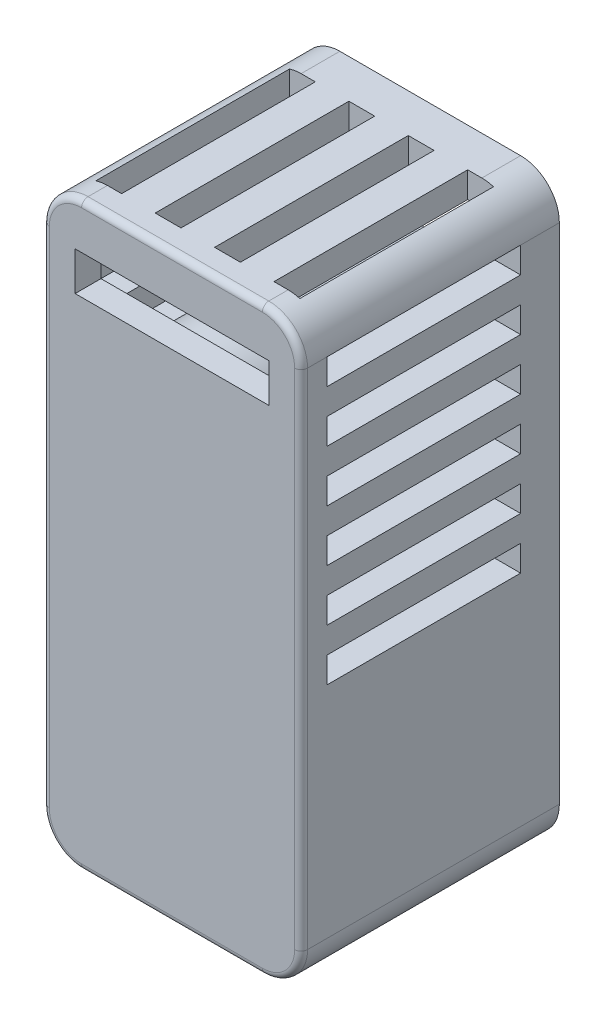
from build123d import *

# Parameters (mm, degrees)
SKETCH2_W           = 20
SKETCH2_H           = 45
BOSS_EXTRUDE1_DEPTH = 20
SHELL1_T            = -2
CUT_EXTRUDE1_REACH  = 38.142
SKETCH3_W           = 15
SKETCH3_H           = 2
CUT_EXTRUDE2_REACH  = 52.249
SKETCH4_W           = 2
SKETCH4_H           = 15
FILLET1_R           = 3
SKETCH7_W           = 15
SKETCH7_H           = 3
CUT_EXTRUDE3_DEPTH  = 2
FILLET3_R           = 0.5
SKETCH8_R           = 5.2
SKETCH8_R_2         = 2.8
BOSS_EXTRUDE2_DEPTH = 16.4


with BuildPart() as part:
    # Sketch2 → Boss-Extrude1 (new body)
    with BuildSketch(Plane.XY):
        Rectangle(SKETCH2_W, SKETCH2_H)
    extrude(amount=BOSS_EXTRUDE1_DEPTH)

    # Shell1
    shell1_openings = [part.faces().sort_by_distance(p)[0] for p in [
        (0, 0, 0),
    ]]
    offset(amount=SHELL1_T, openings=shell1_openings, kind=Kind.INTERSECTION)

    # Cut-Extrude1: up to this face of the body (flat: up to its plane)
    cut_extrude1_end = Plane(part.part.faces().sort_by_distance((-10, 0, 10))[0])
    # Sketch3 → Cut-Extrude1 (cut, up to the picked face)
    with BuildSketch(Plane(origin=(10, 0, 0), x_dir=(0, 0, -1), z_dir=(1, 0, 0)), mode=Mode.PRIVATE) as cut_extrude1_sk1:
        with Locations((-10.5, 18.5)):
            Rectangle(SKETCH3_W, SKETCH3_H)
    cut_extrude1_tool1 = split(extrude(cut_extrude1_sk1.sketch, amount=-CUT_EXTRUDE1_REACH, mode=Mode.PRIVATE), bisect_by=cut_extrude1_end, keep=Keep.BOTH, mode=Mode.PRIVATE)
    # Sketch3 → Cut-Extrude1 (cut, up to the picked face)
    with BuildSketch(Plane(origin=(10, 0, 0), x_dir=(0, 0, -1), z_dir=(1, 0, 0)), mode=Mode.PRIVATE) as cut_extrude1_sk2:
        with Locations((-10.5, 14.5)):
            Rectangle(SKETCH3_W, SKETCH3_H)
    cut_extrude1_tool2 = split(extrude(cut_extrude1_sk2.sketch, amount=-CUT_EXTRUDE1_REACH, mode=Mode.PRIVATE), bisect_by=cut_extrude1_end, keep=Keep.BOTH, mode=Mode.PRIVATE)
    # Sketch3 → Cut-Extrude1 (cut, up to the picked face)
    with BuildSketch(Plane(origin=(10, 0, 0), x_dir=(0, 0, -1), z_dir=(1, 0, 0)), mode=Mode.PRIVATE) as cut_extrude1_sk3:
        with Locations((-10.5, 10.5)):
            Rectangle(SKETCH3_W, SKETCH3_H)
    cut_extrude1_tool3 = split(extrude(cut_extrude1_sk3.sketch, amount=-CUT_EXTRUDE1_REACH, mode=Mode.PRIVATE), bisect_by=cut_extrude1_end, keep=Keep.BOTH, mode=Mode.PRIVATE)
    # Sketch3 → Cut-Extrude1 (cut, up to the picked face)
    with BuildSketch(Plane(origin=(10, 0, 0), x_dir=(0, 0, -1), z_dir=(1, 0, 0)), mode=Mode.PRIVATE) as cut_extrude1_sk4:
        with Locations((-10.5, 6.5)):
            Rectangle(SKETCH3_W, SKETCH3_H)
    cut_extrude1_tool4 = split(extrude(cut_extrude1_sk4.sketch, amount=-CUT_EXTRUDE1_REACH, mode=Mode.PRIVATE), bisect_by=cut_extrude1_end, keep=Keep.BOTH, mode=Mode.PRIVATE)
    # Sketch3 → Cut-Extrude1 (cut, up to the picked face)
    with BuildSketch(Plane(origin=(10, 0, 0), x_dir=(0, 0, -1), z_dir=(1, 0, 0)), mode=Mode.PRIVATE) as cut_extrude1_sk5:
        with Locations((-10.5, 2.5)):
            Rectangle(SKETCH3_W, SKETCH3_H)
    cut_extrude1_tool5 = split(extrude(cut_extrude1_sk5.sketch, amount=-CUT_EXTRUDE1_REACH, mode=Mode.PRIVATE), bisect_by=cut_extrude1_end, keep=Keep.BOTH, mode=Mode.PRIVATE)
    # Sketch3 → Cut-Extrude1 (cut, up to the picked face)
    with BuildSketch(Plane(origin=(10, 0, 0), x_dir=(0, 0, -1), z_dir=(1, 0, 0)), mode=Mode.PRIVATE) as cut_extrude1_sk6:
        with Locations((-10.5, -1.5)):
            Rectangle(SKETCH3_W, SKETCH3_H)
    cut_extrude1_tool6 = split(extrude(cut_extrude1_sk6.sketch, amount=-CUT_EXTRUDE1_REACH, mode=Mode.PRIVATE), bisect_by=cut_extrude1_end, keep=Keep.BOTH, mode=Mode.PRIVATE)
    add(cut_extrude1_tool1.solids().sort_by(Axis((10, 18.5, 10.5), (-1, 0, 0)))[0], mode=Mode.SUBTRACT)
    add(cut_extrude1_tool2.solids().sort_by(Axis((10, 14.5, 10.5), (-1, 0, 0)))[0], mode=Mode.SUBTRACT)
    add(cut_extrude1_tool3.solids().sort_by(Axis((10, 10.5, 10.5), (-1, 0, 0)))[0], mode=Mode.SUBTRACT)
    add(cut_extrude1_tool4.solids().sort_by(Axis((10, 6.5, 10.5), (-1, 0, 0)))[0], mode=Mode.SUBTRACT)
    add(cut_extrude1_tool5.solids().sort_by(Axis((10, 2.5, 10.5), (-1, 0, 0)))[0], mode=Mode.SUBTRACT)
    add(cut_extrude1_tool6.solids().sort_by(Axis((10, -1.5, 10.5), (-1, 0, 0)))[0], mode=Mode.SUBTRACT)

    # Sketch4 → Cut-Extrude2 (cut, up to next)
    with BuildSketch(Plane(origin=(0, 22.5, 0), x_dir=(1, 0, 0), z_dir=(0, 1, 0)), mode=Mode.PRIVATE) as cut_extrude2_sk1:
        with Locations((-6.9, -10.5)):
            Rectangle(SKETCH4_W, SKETCH4_H)
    cut_extrude2_tool1 = extrude(cut_extrude2_sk1.sketch, amount=-CUT_EXTRUDE2_REACH, mode=Mode.PRIVATE) & part.part
    # Sketch4 → Cut-Extrude2 (cut, up to next)
    with BuildSketch(Plane(origin=(0, 22.5, 0), x_dir=(1, 0, 0), z_dir=(0, 1, 0)), mode=Mode.PRIVATE) as cut_extrude2_sk2:
        with Locations((-2.3, -10.5)):
            Rectangle(SKETCH4_W, SKETCH4_H)
    cut_extrude2_tool2 = extrude(cut_extrude2_sk2.sketch, amount=-CUT_EXTRUDE2_REACH, mode=Mode.PRIVATE) & part.part
    # Sketch4 → Cut-Extrude2 (cut, up to next)
    with BuildSketch(Plane(origin=(0, 22.5, 0), x_dir=(1, 0, 0), z_dir=(0, 1, 0)), mode=Mode.PRIVATE) as cut_extrude2_sk3:
        with Locations((2.3, -10.5)):
            Rectangle(SKETCH4_W, SKETCH4_H)
    cut_extrude2_tool3 = extrude(cut_extrude2_sk3.sketch, amount=-CUT_EXTRUDE2_REACH, mode=Mode.PRIVATE) & part.part
    # Sketch4 → Cut-Extrude2 (cut, up to next)
    with BuildSketch(Plane(origin=(0, 22.5, 0), x_dir=(1, 0, 0), z_dir=(0, 1, 0)), mode=Mode.PRIVATE) as cut_extrude2_sk4:
        with Locations((6.9, -10.5)):
            Rectangle(SKETCH4_W, SKETCH4_H)
    cut_extrude2_tool4 = extrude(cut_extrude2_sk4.sketch, amount=-CUT_EXTRUDE2_REACH, mode=Mode.PRIVATE) & part.part
    add(cut_extrude2_tool1.solids().sort_by_distance((-6.9, 22.5, 10.5))[0], mode=Mode.SUBTRACT)
    add(cut_extrude2_tool2.solids().sort_by_distance((-2.3, 22.5, 10.5))[0], mode=Mode.SUBTRACT)
    add(cut_extrude2_tool3.solids().sort_by_distance((2.3, 22.5, 10.5))[0], mode=Mode.SUBTRACT)
    add(cut_extrude2_tool4.solids().sort_by_distance((6.9, 22.5, 10.5))[0], mode=Mode.SUBTRACT)

    # Fillet1
    # the kernel refuses this fillet: 3 mm, written as the material it takes off along each edge
    with BuildSketch(Plane(origin=(10, -22.5, -7.5), x_dir=(-1, 0, 0), z_dir=(0, 0, 1)), Plane(origin=(10, 22.5, -7.5), x_dir=(0, -1, 0), z_dir=(0, 0, 1))) as fillet1_piece_1:
        with BuildLine():
            CenterArc((FILLET1_R, -FILLET1_R), FILLET1_R, 90, 90)
            Line((0, -FILLET1_R), (0, 0))
            Line((0, 0), (FILLET1_R, 0))
        make_face()
    extrude(amount=35, mode=Mode.SUBTRACT)
    with BuildSketch(Plane(origin=(-10, -22.5, -7.5), x_dir=(1, 0, 0), z_dir=(0, 0, 1)), Plane(origin=(-10, 22.5, -7.5), x_dir=(0, -1, 0), z_dir=(0, 0, 1))) as fillet1_piece_2:
        with BuildLine():
            CenterArc((FILLET1_R, FILLET1_R), FILLET1_R, 180, 90)
            Line((0, FILLET1_R), (0, 0))
            Line((0, 0), (FILLET1_R, 0))
        make_face()
    extrude(amount=35, mode=Mode.SUBTRACT)

    # Sketch7 → Cut-Extrude3 (cut)
    with BuildSketch(Plane.XY.offset(20)):
        with Locations((0, 17.5)):
            Rectangle(SKETCH7_W, SKETCH7_H)
    extrude(amount=-CUT_EXTRUDE3_DEPTH, mode=Mode.SUBTRACT)

    # Fillet3
    fillet3_edges = [part.edges().sort_by_distance(p)[0] for p in [
        (10, 0, 20),
        (0, -22.5, 20),
        (-10, 0, 20),
        (0, 22.5, 20),
        (9.121320344, 21.621320344, 20),
        (-9.121320344, 21.621320344, 20),
        (-9.121320344, -21.621320344, 20),
        (9.121320344, -21.621320344, 20),
    ]]
    fillet(fillet3_edges, radius=FILLET3_R)

    # Sketch8 → Boss-Extrude2 (add)
    with BuildSketch(Plane(origin=(0, 0, 18), x_dir=(-1, 0, 0), z_dir=(0, 0, -1))):
        with Locations(Location((0, 10.5, 0), (0, 0, 180))):
            Circle(SKETCH8_R)
        with Locations((0, 10.5)):
            Circle(SKETCH8_R_2, mode=Mode.SUBTRACT)
    extrude(amount=BOSS_EXTRUDE2_DEPTH)


solid = part.part
